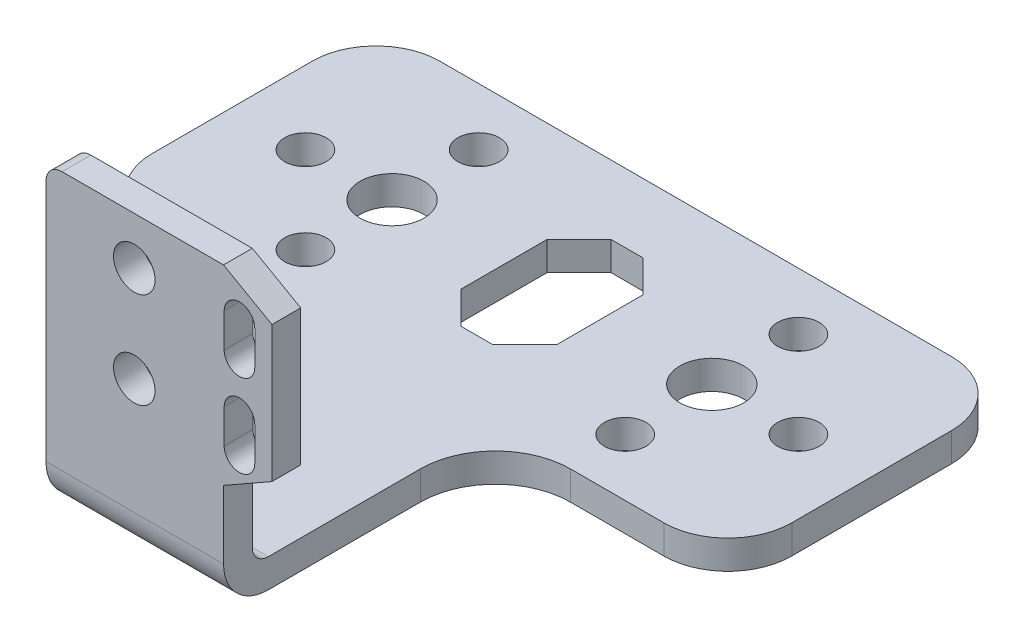
from build123d import *

# Parameters (mm, degrees)
BOSS_EXTRUDE1_DEPTH      = 50
CUT_EXTRUDE34_DEPTH      = 113.361025271
CUT_EXTRUDE34_DEPTH_BACK = 113.361025271
SKETCH2_OUTSIDE_W        = 130.372
SKETCH2_OUTSIDE_H        = 120.372
SKETCH2_OUTSIDE_R        = 5
SKETCH2_OUTSIDE_R_2      = 3.25
BOSS_EXTRUDE3_DEPTH      = 4.5
FILLET3_R                = 2.5
FILLET4_R                = 7
CUT_EXTRUDE35_DEPTH      = 112.411399776
CUT_EXTRUDE35_DEPTH_BACK = 112.411399776
SKETCH6_R                = 3.25
CUT_EXTRUDE39_DEPTH      = 5.18


with BuildPart() as part:
    # Sketch1 → Boss-Extrude1 (new, symmetric)
    with BuildSketch(Plane(origin=(0, 0, 0), x_dir=(0, 0, -1), z_dir=(1, 0, 0))):
        Polygon((0, 0), (0, 45), (4.5, 45), (4.5, 4.5), (90, 4.5), (90, 0), align=None)
    extrude(amount=BOSS_EXTRUDE1_DEPTH, both=True)

    # Sketch2 outside → Cut-Extrude34 (cut, two sides: drawn at the far end of the back side and taken through both)
    # profile 1 of 10: a face of its own
    with BuildSketch(Plane(origin=(0, 0, 0), x_dir=(1, 0, 0), z_dir=(0, 1, 0)).offset(-CUT_EXTRUDE34_DEPTH_BACK)):
        with Locations((0, 45)):
            Rectangle(SKETCH2_OUTSIDE_W, SKETCH2_OUTSIDE_H)
        with BuildLine():
            Line((-40, 45), (-25.836010131, 45))
            ThreePointArc((-25.836010131, 45), (-17.535836731, 41.561955607), (-14.097792338, 33.261782207))
            Line((-14.097792338, 33.261782207), (-14.097792338, 7))
            Line((-14.097792338, 7), (13.661782207, 7))
            Line((13.661782207, 7), (13.661782207, 33.261782207))
            ThreePointArc((13.661782207, 33.261782207), (17.099826599, 41.561955607), (25.4, 45))
            Line((25.4, 45), (40, 45))
            ThreePointArc((40, 45), (47.071067812, 47.928932188), (50, 55))
            Line((50, 55), (50, 80))
            ThreePointArc((50, 80), (47.071067812, 87.071067812), (40, 90))
            Line((40, 90), (-40, 90))
            ThreePointArc((-40, 90), (-47.071067812, 87.071067812), (-50, 80))
            Line((-50, 80), (-50, 55))
            ThreePointArc((-50, 55), (-47.071067812, 47.928932188), (-40, 45))
        make_face(mode=Mode.SUBTRACT)
    # profile 2 of 10: a face of its own
    with BuildSketch(Plane(origin=(0, 0, 0), x_dir=(1, 0, 0), z_dir=(0, 1, 0)).offset(-CUT_EXTRUDE34_DEPTH_BACK)):
        with Locations((-25, 67.5)):
            Circle(SKETCH2_OUTSIDE_R)
    # profile 3 of 10: a face of its own
    with BuildSketch(Plane(origin=(0, 0, 0), x_dir=(1, 0, 0), z_dir=(0, 1, 0)).offset(-CUT_EXTRUDE34_DEPTH_BACK)):
        with Locations((25, 67.5)):
            Circle(SKETCH2_OUTSIDE_R)
    # profile 4 of 10: a face of its own
    with BuildSketch(Plane(origin=(0, 0, 0), x_dir=(1, 0, 0), z_dir=(0, 1, 0)).offset(-CUT_EXTRUDE34_DEPTH_BACK)):
        with Locations((25, 81.04)):
            Circle(SKETCH2_OUTSIDE_R_2)
    # profile 5 of 10: a face of its own
    with BuildSketch(Plane(origin=(0, 0, 0), x_dir=(1, 0, 0), z_dir=(0, 1, 0)).offset(-CUT_EXTRUDE34_DEPTH_BACK)):
        with Locations((25, 53.96)):
            Circle(SKETCH2_OUTSIDE_R_2)
    # profile 6 of 10: a face of its own
    with BuildSketch(Plane(origin=(0, 0, 0), x_dir=(1, 0, 0), z_dir=(0, 1, 0)).offset(-CUT_EXTRUDE34_DEPTH_BACK)):
        with Locations((38.54, 67.5)):
            Circle(SKETCH2_OUTSIDE_R_2)
    # profile 7 of 10: a face of its own
    with BuildSketch(Plane(origin=(0, 0, 0), x_dir=(1, 0, 0), z_dir=(0, 1, 0)).offset(-CUT_EXTRUDE34_DEPTH_BACK)):
        with Locations((-25, 81.04)):
            Circle(SKETCH2_OUTSIDE_R_2)
    # profile 8 of 10: a face of its own
    with BuildSketch(Plane(origin=(0, 0, 0), x_dir=(1, 0, 0), z_dir=(0, 1, 0)).offset(-CUT_EXTRUDE34_DEPTH_BACK)):
        with Locations((-25, 53.96)):
            Circle(SKETCH2_OUTSIDE_R_2)
    # profile 9 of 10: a face of its own
    with BuildSketch(Plane(origin=(0, 0, 0), x_dir=(1, 0, 0), z_dir=(0, 1, 0)).offset(-CUT_EXTRUDE34_DEPTH_BACK)):
        with Locations((-38.54, 67.5)):
            Circle(SKETCH2_OUTSIDE_R_2)
    # profile 10 of 10: a face of its own
    with BuildSketch(Plane(origin=(0, 0, 0), x_dir=(1, 0, 0), z_dir=(0, 1, 0)).offset(-CUT_EXTRUDE34_DEPTH_BACK)):
        Polygon((-2.5, 79.24), (2.5, 79.24), (7.5, 74.24), (7.5, 60.76), (2.5, 55.76), (-2.5, 55.76), (-7.5, 60.76), (-7.5, 74.24), align=None)
    extrude(amount=CUT_EXTRUDE34_DEPTH + CUT_EXTRUDE34_DEPTH_BACK, mode=Mode.SUBTRACT)

    # Sketch4 → Boss-Extrude3 (add)
    with BuildSketch(Plane.XY.offset(-7)):
        with BuildLine():
            Line((-14.097792338, 0), (-14.097792338, 45))
            ThreePointArc((-14.097792338, 45), (-13.365559291, 46.767766953), (-11.597792338, 47.5))
            Line((-11.597792338, 47.5), (13.661782207, 47.5))
            Line((13.661782207, 47.5), (21.222778521, 43.209368433))
            Line((21.222778521, 43.209368433), (21.222778521, 21.944029683))
            Line((21.222778521, 21.944029683), (13.661782207, 17.653398116))
            Line((13.661782207, 17.653398116), (13.661782207, 4.5))
            Line((13.661782207, 4.5), (13.661782207, 0))
            Line((13.661782207, 0), (-14.097792338, 0))
        make_face()
    extrude(amount=BOSS_EXTRUDE3_DEPTH)

    # Fillet3
    fillet3_edges = [part.edges().sort_by_distance(p)[0] for p in [
        (-0.218005066, 4.5, -7),
    ]]
    fillet(fillet3_edges, radius=FILLET3_R)

    # Fillet4
    fillet4_edges = [part.edges().sort_by_distance(p)[0] for p in [
        (-0.218005066, 0, -2.5),
    ]]
    fillet(fillet4_edges, radius=FILLET4_R)

    # Sketch6 → Cut-Extrude35 (cut, two sides: drawn at the far end of the back side and taken through both)
    with BuildSketch(Plane.XY.offset(-2.5).offset(-CUT_EXTRUDE35_DEPTH_BACK)):
        with Locations((-0.297792338, 40.083077312)):
            Circle(SKETCH6_R)
        with Locations((-0.297792338, 25.083077312)):
            Circle(SKETCH6_R)
    extrude(amount=CUT_EXTRUDE35_DEPTH + CUT_EXTRUDE35_DEPTH_BACK, mode=Mode.SUBTRACT)

    # Sketch7 → Cut-Extrude39 (cut)
    with BuildSketch(Plane.XY.offset(-2.5)):
        with BuildLine():
            Line((18.539617084, 41.355633115), (18.539617084, 36.032215871))
            ThreePointArc((18.539617084, 36.032215871), (16.149617084, 33.642215871), (13.759617084, 36.032215871))
            Line((13.759617084, 36.032215871), (13.759617084, 41.355633115))
            ThreePointArc((13.759617084, 41.355633115), (16.149617084, 43.745633115), (18.539617084, 41.355633115))
        make_face()
        with BuildLine():
            Line((18.539617084, 28.355633115), (18.539617084, 23.032215871))
            ThreePointArc((18.539617084, 23.032215871), (16.149617084, 20.642215871), (13.759617084, 23.032215871))
            Line((13.759617084, 23.032215871), (13.759617084, 28.355633115))
            ThreePointArc((13.759617084, 28.355633115), (16.149617084, 30.745633115), (18.539617084, 28.355633115))
        make_face()
    extrude(amount=-CUT_EXTRUDE39_DEPTH, mode=Mode.SUBTRACT)


solid = part.part
